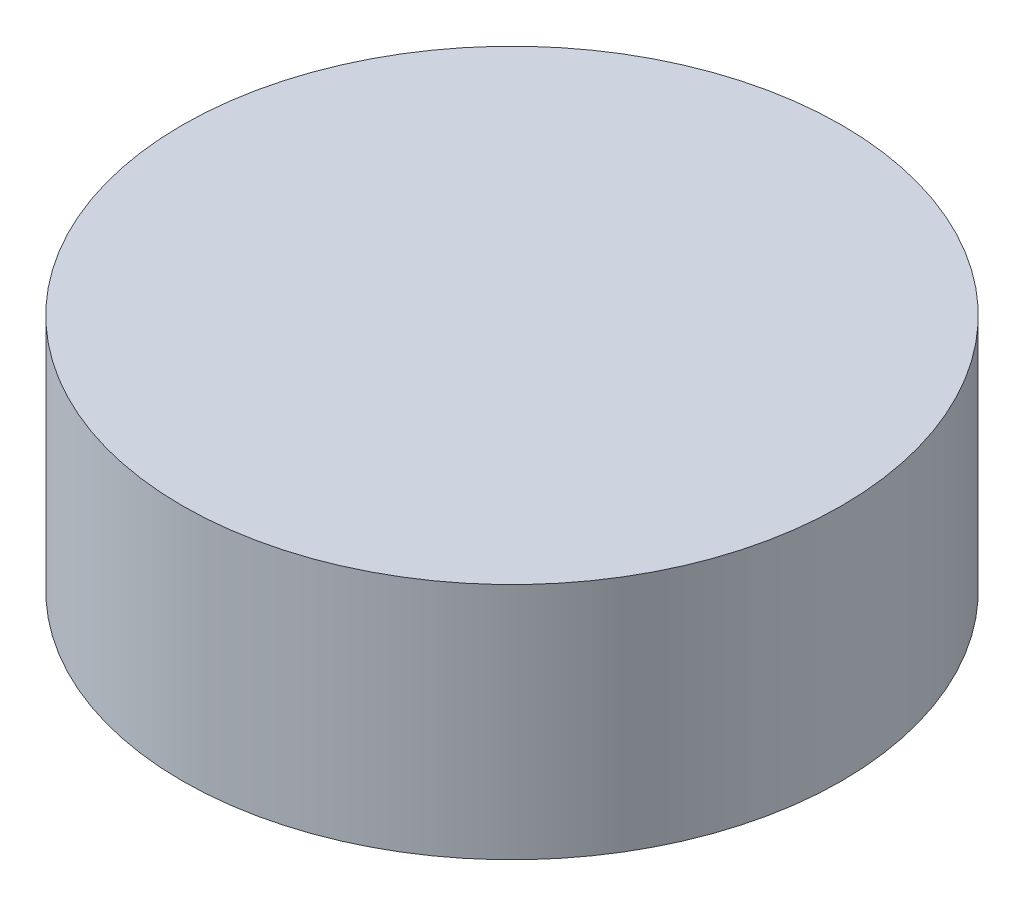
from build123d import *

# Parameters (mm, degrees)
BOSS_EXTRUDE2_DEPTH      = 2
BOSS_EXTRUDE2_DEPTH_BACK = 7
SKETCH2_R                = 12.45
SKETCH3_R                = 1.475
CUT_EXTRUDE1_DEPTH       = 6.05
SKETCH4_R                = 7
CUT_EXTRUDE2_DEPTH       = 4.05


with BuildPart() as part:
    # Sketch2 → Boss-Extrude2 (new, two sides: drawn at the far end of the back side and taken through both)
    with BuildSketch(Plane(origin=(0, 14, 0), x_dir=(1, 0, 0), z_dir=(0, 1, 0)).offset(-BOSS_EXTRUDE2_DEPTH_BACK)):
        with Locations((-0.498, 0)):
            Circle(SKETCH2_R)
    extrude(amount=BOSS_EXTRUDE2_DEPTH + BOSS_EXTRUDE2_DEPTH_BACK)

    # Sketch3 → Cut-Extrude1 (cut)
    with BuildSketch(Plane.XZ.offset(-7)):
        with Locations((9.5, 0)):
            Circle(SKETCH3_R)
        with Locations((4.5, -8.660254038)):
            Circle(SKETCH3_R)
        with Locations((-5.5, -8.660254038)):
            Circle(SKETCH3_R)
        with Locations((-10.5, 0)):
            Circle(SKETCH3_R)
        with Locations((-5.5, 8.660254038)):
            Circle(SKETCH3_R)
        with Locations((4.5, 8.660254038)):
            Circle(SKETCH3_R)
    extrude(amount=-CUT_EXTRUDE1_DEPTH, mode=Mode.SUBTRACT)

    # Sketch4 → Cut-Extrude2 (cut)
    with BuildSketch(Plane.XZ.offset(-7)):
        with Locations((-0.5, 0)):
            Circle(SKETCH4_R)
    extrude(amount=-CUT_EXTRUDE2_DEPTH, mode=Mode.SUBTRACT)


solid = part.part
